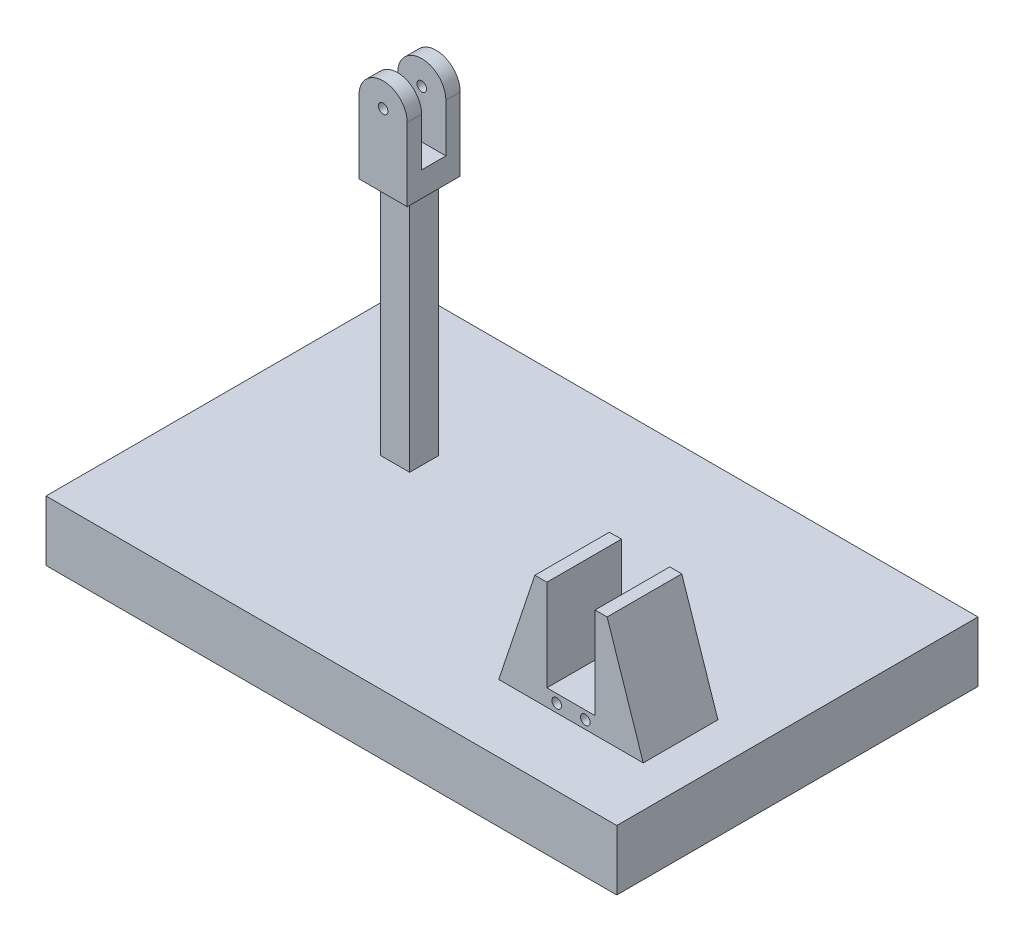
from build123d import *

# Parameters (mm, degrees)
EXTRUDE_1_DEPTH      = 12
CUT_EXTRUDE_1_DEPTH  = 39.218600963
CUT_EXTRUDE_6_DEPTH  = 39.218600963
SKETCH_12_R          = 1.985
EXTRUDE_11_DEPTH     = 5
EXTRUDE_START        = 5
SKETCH_13_R          = 1.985
EXTRUDE_12_DEPTH     = 5
SKETCH_14_W          = 10.08
SKETCH_14_H          = 30
CUT_EXTRUDE_7_DEPTH  = 41.070705753
SKETCH_15_W          = 12
SKETCH_15_H          = 12
EXTRUDE_13_DEPTH     = 100
SKETCH_16_W          = 237
SKETCH_16_H          = 150
EXTRUDE_14_DEPTH     = 25
EXTRUDE_19_DEPTH     = 7
SKETCH_31_W          = 5
SKETCH_31_H          = 31
EXTRUDE_20_DEPTH     = 45
EXTRUDE_21_DEPTH     = 31
SKETCH_35_R          = 2
CUT_EXTRUDE_16_DEPTH = 252.729549014


with BuildPart() as part:
    # 草圖1 → 填料-伸長1 (new body)
    with BuildSketch(Plane.XY):
        with BuildLine():
            ThreePointArc((10, 0), (0, 10), (-10, 0))
            Line((-10, 0), (-10, -30.276417548))
            Line((-10, -30.276417548), (10, -30.276417548))
            Line((10, -30.276417548), (10, 0))
        make_face()
        with BuildLine():
            ThreePointArc((0, -1.985), (-1.403606961, 1.403606961), (1.985, 0))
            ThreePointArc((1.985, 0), (1.403606961, -1.403606961), (0, -1.985))
        make_face(mode=Mode.SUBTRACT)
    extrude(amount=EXTRUDE_1_DEPTH)

    # 草圖2 → 除料-伸長1 (cut, through all)
    with BuildSketch(Plane(origin=(10, 0, 0), x_dir=(0, 0, -1), z_dir=(1, 0, 0))):
        Polygon((-9, 15.780779257), (-9, 0), (-8.60053373, -20), (-3, -20), (-3, 15.780779257), align=None)
    extrude(amount=-CUT_EXTRUDE_1_DEPTH, mode=Mode.SUBTRACT)

    # 草圖11 → 除料-伸長6 (cut, through all)
    with BuildSketch(Plane(origin=(10, 0, 0), x_dir=(0, 0, -1), z_dir=(1, 0, 0))):
        Polygon((-9, 0), (-9, -20), (-8.60053373, -20), align=None)
    extrude(amount=-CUT_EXTRUDE_6_DEPTH, mode=Mode.SUBTRACT)

    # 草圖12 → 填料-伸長11 (add)
    with BuildSketch(Plane.XY.offset(12)):
        with BuildLine():
            Line((10, -30.276417548), (10, 0))
            ThreePointArc((10, 0), (0, 10), (-10, 0))
            Line((-10, 0), (-10, -30.276417548))
            Line((-10, -30.276417548), (10, -30.276417548))
        make_face()
        Circle(SKETCH_12_R, mode=Mode.SUBTRACT)
    extrude(amount=EXTRUDE_11_DEPTH)

    # 草圖13 → 填料-伸長12 (add)
    with BuildSketch(Plane(origin=(0, 0, 0), x_dir=(-1, 0, 0), z_dir=(0, 0, -1)).offset(EXTRUDE_START)):
        with BuildLine():
            Line((10, -30.276417548), (10, 0))
            ThreePointArc((10, 0), (0, 10), (-10, 0))
            Line((-10, 0), (-10, -30.276417548))
            Line((-10, -30.276417548), (10, -30.276417548))
        make_face()
        Circle(SKETCH_13_R, mode=Mode.SUBTRACT)
    extrude(amount=-EXTRUDE_12_DEPTH)

    # 草圖14 → 除料-伸長7 (cut, through all)
    with BuildSketch(Plane.ZY.offset(10)):
        with Locations((6, -5)):
            Rectangle(SKETCH_14_W, SKETCH_14_H)
    extrude(amount=-CUT_EXTRUDE_7_DEPTH, mode=Mode.SUBTRACT)

    # 草圖15 → 填料-伸長13 (add)
    with BuildSketch(Plane.XZ.offset(30.276417548)):
        with Locations((0, 6)):
            Rectangle(SKETCH_15_W, SKETCH_15_H)
    extrude(amount=EXTRUDE_13_DEPTH)

    # 草圖16 → 填料-伸長14 (add)
    with BuildSketch(Plane.XZ.offset(130.276417548)):
        with Locations((57.5, 21)):
            Rectangle(SKETCH_16_W, SKETCH_16_H)
    extrude(amount=EXTRUDE_14_DEPTH)

    # 草圖30 → 填料-伸長19 (add)
    with BuildSketch(Plane(origin=(0, -130.276417548, 0), x_dir=(1, 0, 0), z_dir=(0, 1, 0))):
        Polygon((139, -37), (129, -37), (119, -37), (119, -68), (139, -68), align=None)
    extrude(amount=EXTRUDE_19_DEPTH)

    # 草圖31 → 填料-伸長20 (add)
    with BuildSketch(Plane(origin=(0, -130.276417548, 0), x_dir=(1, 0, 0), z_dir=(0, 1, 0))):
        Polygon((119, -68), (114, -68), (114, -37.129725066), (119, -37), align=None)
        with Locations((141.5, -52.5)):
            Rectangle(SKETCH_31_W, SKETCH_31_H)
    extrude(amount=EXTRUDE_20_DEPTH)

    # 草圖33 → 填料-伸長21 (add)
    with BuildSketch(Plane.XY.offset(68)):
        Polygon((114, -130.276417548), (114, -85.276417548), (99, -130.276417548), align=None)
        Polygon((159, -130.276417548), (144, -85.276417548), (144, -130.276417548), align=None)
    extrude(amount=-EXTRUDE_21_DEPTH)

    # 草圖35 → 除料-伸長16 (cut, through all)
    with BuildSketch(Plane(origin=(0, 0, 37), x_dir=(-1, 0, 0), z_dir=(0, 0, -1))):
        with Locations((-134.95, -126.776417548)):
            Circle(SKETCH_35_R)
        with Locations((-123.05, -126.776417548)):
            Circle(SKETCH_35_R)
    extrude(amount=-CUT_EXTRUDE_16_DEPTH, mode=Mode.SUBTRACT)


solid = part.part
